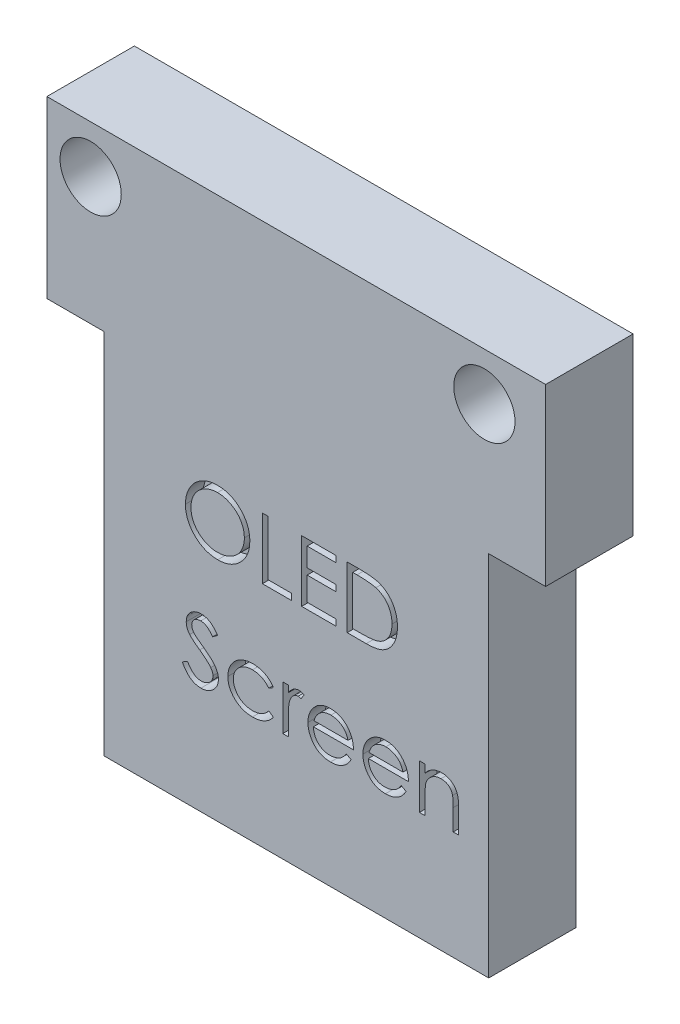
from build123d import *

# Parameters (mm, degrees)
SKETCH1_R           = 1.75
BOSS_EXTRUDE1_DEPTH = 5
CUT_EXTRUDE1_DEPTH  = 1


with BuildPart() as part:
    # Sketch1 → Boss-Extrude1 (new body)
    with BuildSketch(Plane.XY):
        Polygon((14.25, 15.5), (-14.25, 15.5), (-14.25, 5.5), (-11, 5.5), (-11, -15.5), (11, -15.5), (11, 5.5), (14.25, 5.5), align=None)
        with Locations((-11.75, 12.780701754)):
            Circle(SKETCH1_R, mode=Mode.SUBTRACT)
        with Locations((10.75, 12.780701754)):
            Circle(SKETCH1_R, mode=Mode.SUBTRACT)
    extrude(amount=BOSS_EXTRUDE1_DEPTH)

    # Sketch2 → Cut-Extrude1 (cut)
    # profile 1 of 10: a face of its own
    with BuildSketch(Plane.XY.offset(5)):
        with BuildLine():
            add(Edge.make_bspline(
                [(-4.514991702, 1.136077511), (-4.450183596, 1.134436032), (-4.322895129, 1.131212031), (-4.135820231, 1.106532927), (-3.957225136, 1.063837538), (-3.785654997, 1.006974555), (-3.623162021, 0.93112017), (-3.468523128, 0.839435021), (-3.322106254, 0.730958563), (-3.185884873, 0.606529336), (-3.061227922, 0.471145882), (-2.951402036, 0.326667972), (-2.859359742, 0.173969169), (-2.783773955, 0.013508339), (-2.724475346, -0.154351629), (-2.683556302, -0.330505632), (-2.657418152, -0.513812322), (-2.654362374, -0.638839187), (-2.652812215, -0.702263835)],
                knots=[0, 0, 0, 0, 1.065120563, 2.091984664, 3.0946048, 4.079830382, 5.057816894, 6.036188127, 7.030412546, 8.04752943, 9.064399622, 10.05169764, 11.02544977, 11.989514704, 12.962713494, 13.945757189, 14.957906945, 16, 16, 16, 16], degree=3))
            add(Edge.make_bspline(
                [(-2.652812215, -0.702263835), (-2.654362147, -0.765221281), (-2.657417244, -0.889317702), (-2.683586021, -1.071461146), (-2.724627021, -1.246551842), (-2.783223287, -1.414297495), (-2.858448766, -1.574875059), (-2.951103937, -1.727862013), (-3.060245148, -1.873308511), (-3.184451999, -2.009621176), (-3.319853041, -2.134618647), (-3.465083308, -2.243537523), (-3.616876628, -2.337261647), (-3.777186336, -2.412045321), (-3.943886373, -2.471817242), (-4.118468696, -2.512569872), (-4.30011525, -2.538856915), (-4.423986253, -2.541875431), (-4.48694683, -2.543409668)],
                knots=[0, 0, 0, 0, 1.043624062, 2.057103931, 3.04512605, 4.022047818, 4.998200453, 5.980619268, 6.982898556, 8.009068085, 9.034988726, 10.034168286, 11.015286542, 11.987931943, 12.962482838, 13.94673481, 14.956375938, 16, 16, 16, 16], degree=3))
            add(Edge.make_bspline(
                [(-4.48694683, -2.543409668), (-4.550371149, -2.541860281), (-4.675397365, -2.538806027), (-4.8589344, -2.512624623), (-5.035212144, -2.471683319), (-5.203726495, -2.413173883), (-5.364571425, -2.337556652), (-5.518061508, -2.245352273), (-5.663580655, -2.135945132), (-5.799922401, -2.011778557), (-5.9246716, -1.876607005), (-6.033430975, -1.73177275), (-6.125656089, -1.580117293), (-6.201019421, -1.421219769), (-6.26068388, -1.255848326), (-6.301388699, -1.082899849), (-6.327724651, -0.903360343), (-6.330759497, -0.781117445), (-6.332299394, -0.719090758)],
                knots=[0, 0, 0, 0, 1.053102029, 2.075944431, 3.073151272, 4.055350789, 5.033113405, 6.020478099, 7.024410459, 8.052272461, 9.079885166, 10.07527673, 11.055994387, 12.023226415, 12.992069828, 13.970394897, 14.97016774, 16, 16, 16, 16], degree=3))
            add(Edge.make_bspline(
                [(-6.332299394, -0.719090758), (-6.331764759, -0.677458089), (-6.330702232, -0.594717965), (-6.31791054, -0.471851365), (-6.299348839, -0.350960707), (-6.272746926, -0.232389759), (-6.237955259, -0.116428775), (-6.196903232, -0.002278012), (-6.146763386, 0.108905712), (-6.090082738, 0.217649104), (-6.02682093, 0.322257009), (-5.956945181, 0.421136593), (-5.882909812, 0.515117589), (-5.801746419, 0.601764593), (-5.716129974, 0.68359825), (-5.624671595, 0.759360967), (-5.527929351, 0.829735918), (-5.425486971, 0.893156259), (-5.319868696, 0.950515393), (-5.210991919, 0.999737244), (-5.100335347, 1.041983306), (-4.987380699, 1.076224131), (-4.872427927, 1.103256167), (-4.755226143, 1.121663521), (-4.635868716, 1.134487839), (-4.555457397, 1.135545341), (-4.514991702, 1.136077511)],
                knots=[0, 0, 0, 0, 1.037015668, 2.060948919, 3.074880161, 4.083647147, 5.086022904, 6.090072063, 7.104153813, 8.122640571, 9.144368836, 10.147691507, 11.138137339, 12.123020368, 13.103399296, 14.087645067, 15.080126199, 16.082011238, 17.087798457, 18.072939717, 19.057185487, 20.037253025, 21.01195951, 21.997135196, 22.992090687, 24, 24, 24, 24], degree=3))
        make_face()
        with BuildLine():
            add(Edge.make_bspline(
                [(-4.499567022, 0.777103152), (-4.532781656, 0.776698262), (-4.598893389, 0.775892352), (-4.697177925, 0.765276637), (-4.794169859, 0.750146748), (-4.889889221, 0.728565227), (-4.98393551, 0.699161174), (-5.077185352, 0.665320266), (-5.168788405, 0.624099176), (-5.258442263, 0.577526471), (-5.345357338, 0.52597755), (-5.42737004, 0.469005783), (-5.504692684, 0.407947229), (-5.577135951, 0.342659392), (-5.644487123, 0.27280979), (-5.708071824, 0.199457354), (-5.765341406, 0.120505463), (-5.817826983, 0.038095056), (-5.864794823, -0.047666525), (-5.906560178, -0.135876388), (-5.940724186, -0.227254074), (-5.968586563, -0.320808232), (-5.991686374, -0.416390692), (-6.006320298, -0.51472654), (-6.017052657, -0.615321653), (-6.017812503, -0.683303507), (-6.01819683, -0.717688514)],
                knots=[0, 0, 0, 0, 1.008559885, 2.007477868, 2.99961109, 3.989939068, 4.984837346, 5.991145699, 7.001802488, 8.033829008, 9.059044045, 10.069351652, 11.065060232, 12.050310815, 13.029377138, 14.011219647, 14.996725999, 15.989392538, 16.977580475, 17.965360261, 18.951710183, 19.937753436, 20.929683414, 21.935841486, 22.955955122, 24, 24, 24, 24], degree=3))
            add(Edge.make_bspline(
                [(-6.01819683, -0.717688514), (-6.016921968, -0.768250735), (-6.01441392, -0.867722265), (-5.99245635, -1.013490409), (-5.958634376, -1.153578696), (-5.908777009, -1.287220605), (-5.846426395, -1.415564888), (-5.769399504, -1.537472992), (-5.678140419, -1.652977867), (-5.574476892, -1.761273136), (-5.461154185, -1.86011894), (-5.340821456, -1.946882349), (-5.214767848, -2.020292598), (-5.082664645, -2.080097671), (-4.945217106, -2.127487409), (-4.801539555, -2.15996604), (-4.652589096, -2.181341495), (-4.551058441, -2.183394251), (-4.499567022, -2.184435309)],
                knots=[0, 0, 0, 0, 1.032063989, 2.030389145, 3.003944642, 3.970395727, 4.937377036, 5.913328081, 6.909231446, 7.93887556, 8.970685674, 9.976071282, 10.964166581, 11.944589148, 12.933237628, 13.927779006, 14.949070134, 16, 16, 16, 16], degree=3))
            add(Edge.make_bspline(
                [(-4.499567022, -2.184435309), (-4.464957521, -2.183959805), (-4.396316484, -2.183016737), (-4.294220962, -2.17351806), (-4.19396475, -2.158286191), (-4.09568847, -2.136355535), (-3.999503659, -2.108908329), (-3.905008856, -2.076300601), (-3.813210566, -2.035619397), (-3.722950728, -1.990671445), (-3.636554486, -1.939431288), (-3.554078954, -1.884393138), (-3.477602974, -1.823424517), (-3.405213903, -1.759106705), (-3.337586214, -1.690142857), (-3.275177229, -1.616622635), (-3.218197097, -1.538081978), (-3.165731451, -1.455796572), (-3.118928188, -1.36980032), (-3.078149089, -1.281270642), (-3.043552973, -1.190425532), (-3.015624468, -1.097133961), (-2.993739006, -1.001573112), (-2.978659086, -0.903615034), (-2.968110648, -0.803455691), (-2.967315571, -0.735711835), (-2.966914779, -0.701562713)],
                knots=[0, 0, 0, 0, 1.047197238, 2.076906641, 3.100256066, 4.114471768, 5.12198147, 6.126382909, 7.136867548, 8.15857795, 9.17633901, 10.174870724, 11.156907918, 12.133735059, 13.104061851, 14.077631395, 15.04955518, 16.038496417, 17.029181396, 18.010275684, 18.986308667, 19.968651475, 20.955262928, 21.950658345, 22.966943676, 24, 24, 24, 24], degree=3))
            add(Edge.make_bspline(
                [(-2.966914779, -0.701562713), (-2.967315892, -0.667647209), (-2.968111573, -0.600369559), (-2.978654048, -0.50090874), (-2.993754938, -0.403655529), (-3.015517646, -0.308991726), (-3.0435678, -0.216893201), (-3.07815513, -0.127446453), (-3.11894043, -0.040318258), (-3.165748654, 0.044276039), (-3.218364478, 0.125450777), (-3.275858721, 0.20305319), (-3.339224069, 0.275625931), (-3.406650094, 0.344960625), (-3.479820979, 0.409578515), (-3.558405273, 0.469501035), (-3.641448951, 0.52617431), (-3.729376187, 0.577299871), (-3.82012014, 0.624514104), (-3.913234098, 0.664965107), (-4.007663198, 0.699337227), (-4.10316731, 0.728654192), (-4.200550289, 0.750062222), (-4.299154117, 0.765290272), (-4.398842376, 0.775888658), (-4.465885596, 0.776697036), (-4.499567022, 0.777103152)],
                knots=[0, 0, 0, 0, 1.02996197, 2.043119294, 3.035359645, 4.018872909, 4.991431989, 5.957985074, 6.929999688, 7.912076566, 8.892894881, 9.867085534, 10.843653904, 11.817741046, 12.803660682, 13.806313499, 14.818574707, 15.856120519, 16.894564902, 17.924820532, 18.937903209, 19.946497019, 20.957711757, 21.963978472, 22.977135795, 24, 24, 24, 24], degree=3))
        make_face(mode=Mode.SUBTRACT)
    # profile 2 of 10: a face of its own
    with BuildSketch(Plane.XY.offset(5)):
        Polygon((-1.934863497, 1.046333922), (-1.620760933, 1.046333922), (-1.620760933, -2.094691719), (-0.274607086, -2.094691719), (-0.274607086, -2.453666078), (-1.934863497, -2.453666078), align=None)
    # profile 3 of 10: a face of its own
    with BuildSketch(Plane.XY.offset(5)):
        Polygon((0.308726247, 1.046333922), (2.283085221, 1.046333922), (2.283085221, 0.687359563), (0.622828811, 0.687359563), (0.622828811, -0.389563514), (2.283085221, -0.389563514), (2.283085221, -0.748537873), (0.622828811, -0.748537873), (0.622828811, -2.094691719), (2.283085221, -2.094691719), (2.283085221, -2.453666078), (0.308726247, -2.453666078), align=None)
    # profile 4 of 10: a face of its own
    with BuildSketch(Plane.XY.offset(5)):
        with BuildLine():
            Line((2.911290349, -2.453666078), (2.911290349, 1.046333922))
            Line((2.911290349, 1.046333922), (3.618021119, 1.046333922))
            add(Edge.make_bspline(
                [(3.618021119, 1.046333922), (3.679490107, 1.045891352), (3.798247872, 1.045036309), (3.96986032, 1.039614918), (4.128644082, 1.030024452), (4.274076941, 1.016054926), (4.406558153, 0.998901892), (4.525716761, 0.977401488), (4.632168904, 0.952013317), (4.697638345, 0.930367867), (4.728598042, 0.920131999)],
                knots=[0, 0, 0, 0, 1.314313732, 2.53924729, 3.670748893, 4.714932338, 5.66265055, 6.526160246, 7.303039223, 8, 8, 8, 8], degree=3))
            add(Edge.make_bspline(
                [(4.728598042, 0.920131999), (4.769092781, 0.904701293), (4.849163973, 0.874189799), (4.963171096, 0.816633497), (5.070496459, 0.751420396), (5.171715604, 0.678464533), (5.26451643, 0.595700185), (5.352524327, 0.506643099), (5.432139051, 0.408054759), (5.505047347, 0.301979771), (5.570783006, 0.189667718), (5.627922164, 0.07133261), (5.675376157, -0.052424598), (5.714769384, -0.181259746), (5.745815842, -0.315456124), (5.766997773, -0.45516999), (5.780968763, -0.59984918), (5.782372814, -0.698023643), (5.783085221, -0.747836751)],
                knots=[0, 0, 0, 0, 0.984719456, 1.947108742, 2.898477687, 3.838006223, 4.779231079, 5.722358779, 6.681677486, 7.655904652, 8.64651281, 9.637519902, 10.640069247, 11.656948941, 12.698408672, 13.768548281, 14.867775369, 16, 16, 16, 16], degree=3))
            add(Edge.make_bspline(
                [(5.783085221, -0.747836751), (5.782456254, -0.79109799), (5.781216808, -0.876348779), (5.770087492, -1.001989675), (5.753911172, -1.123903246), (5.728866974, -1.241508946), (5.69846446, -1.355837164), (5.659500309, -1.465669408), (5.614864813, -1.572013217), (5.562814934, -1.673430693), (5.505673549, -1.769514066), (5.444351806, -1.860089594), (5.378915111, -1.943864816), (5.308739478, -2.021093428), (5.234731761, -2.091659006), (5.156407431, -2.156151021), (5.07356438, -2.213307576), (4.986573657, -2.265374685), (4.892897528, -2.31079504), (4.790761662, -2.34922505), (4.679730484, -2.381071665), (4.560076527, -2.407642561), (4.431593049, -2.428719864), (4.294154084, -2.442846256), (4.147970794, -2.452399189), (4.047591529, -2.453235582), (3.995925766, -2.453666078)],
                knots=[0, 0, 0, 0, 1.105936401, 2.179363191, 3.223086493, 4.248585256, 5.251745608, 6.245858792, 7.225916811, 8.198733463, 9.158002045, 10.082870192, 10.993790845, 11.873723703, 12.748670949, 13.606408763, 14.465103618, 15.319838547, 16.196477973, 17.123216899, 18.106603292, 19.147568657, 20.255746949, 21.433717677, 22.679120308, 24, 24, 24, 24], degree=3))
            Line((3.995925766, -2.453666078), (2.911290349, -2.453666078))
        make_face()
        with BuildLine():
            Line((3.225392914, -2.094691719), (3.627135702, -2.094691719))
            add(Edge.make_bspline(
                [(3.627135702, -2.094691719), (3.684864073, -2.094443623), (3.795896871, -2.093966443), (3.955554868, -2.08977924), (4.101434265, -2.082937302), (4.233555774, -2.073362224), (4.351844799, -2.060693609), (4.456548549, -2.046568707), (4.547323807, -2.028971256), (4.602253244, -2.013020296), (4.627636503, -2.005649251)],
                knots=[0, 0, 0, 0, 1.375205317, 2.645023457, 3.804390687, 4.853969522, 5.800190428, 6.637939096, 7.370582563, 8, 8, 8, 8], degree=3))
            add(Edge.make_bspline(
                [(4.627636503, -2.005649251), (4.659584865, -1.994397693), (4.722718504, -1.97216332), (4.813599589, -1.931605659), (4.898356593, -1.883563589), (4.978466619, -1.830161315), (5.052793274, -1.769515313), (5.12221739, -1.702944324), (5.186599192, -1.630109549), (5.2452735, -1.551101388), (5.297781804, -1.466411592), (5.343253033, -1.376872758), (5.383104565, -1.283465948), (5.414383157, -1.184756789), (5.438898742, -1.081627731), (5.45626343, -0.974071518), (5.467078154, -0.862108236), (5.468339602, -0.785956112), (5.468982657, -0.74713563)],
                knots=[0, 0, 0, 0, 0.998632004, 1.973411704, 2.929992603, 3.868527914, 4.809262121, 5.754881198, 6.702106254, 7.672490631, 8.653608572, 9.636854334, 10.631411391, 11.644891563, 12.686317036, 13.754757253, 14.855430412, 16, 16, 16, 16], degree=3))
            add(Edge.make_bspline(
                [(5.468982657, -0.74713563), (5.46846937, -0.706202149), (5.467461012, -0.625787965), (5.454786702, -0.50779727), (5.436265146, -0.394316619), (5.40948146, -0.285338424), (5.375350581, -0.180650072), (5.33275594, -0.080830561), (5.28408932, 0.015174307), (5.226185984, 0.105148673), (5.16277039, 0.190241782), (5.092392511, 0.268196698), (5.016170472, 0.339190998), (4.934935623, 0.404330311), (4.846398524, 0.460993987), (4.752644833, 0.511680668), (4.652299162, 0.554696559), (4.582486466, 0.577575422), (4.547007497, 0.589202511)],
                knots=[0, 0, 0, 0, 1.122418816, 2.205001699, 3.251619955, 4.274784885, 5.280384055, 6.268708349, 7.249350384, 8.229342522, 9.199999885, 10.157847722, 11.105861043, 12.055065948, 13.010012805, 13.98527497, 14.976112212, 16, 16, 16, 16], degree=3))
            add(Edge.make_bspline(
                [(4.547007497, 0.589202511), (4.517656351, 0.597318939), (4.45524776, 0.614576692), (4.353408296, 0.633402064), (4.238793147, 0.650006563), (4.110893446, 0.664064603), (3.969854987, 0.674151924), (3.815569299, 0.681723239), (3.647969694, 0.686829871), (3.53178716, 0.687178578), (3.471486664, 0.687359563)],
                knots=[0, 0, 0, 0, 0.674548936, 1.434276114, 2.292660221, 3.240891867, 4.284742987, 5.42552168, 6.663806718, 8, 8, 8, 8], degree=3))
            Line((3.471486664, 0.687359563), (3.225392914, 0.687359563))
            Line((3.225392914, 0.687359563), (3.225392914, -2.094691719))
        make_face(mode=Mode.SUBTRACT)
    # profile 5 of 10: a face of its own
    with BuildSketch(Plane.XY.offset(5)):
        with BuildLine():
            Line((-6.511786574, -8.611819123), (-6.215913176, -8.434435309))
            add(Edge.make_bspline(
                [(-6.215913176, -8.434435309), (-6.188394939, -8.480499694), (-6.135671058, -8.568757278), (-6.047719699, -8.688015318), (-5.956586788, -8.789377475), (-5.861597454, -8.872254083), (-5.763331506, -8.93750297), (-5.661147453, -8.983705201), (-5.555389642, -9.012521177), (-5.48341582, -9.016021263), (-5.447483689, -9.017768643)],
                knots=[0, 0, 0, 0, 1.272034388, 2.437168799, 3.508375237, 4.49857839, 5.41946034, 6.295179144, 7.148887113, 8, 8, 8, 8], degree=3))
            add(Edge.make_bspline(
                [(-5.447483689, -9.017768643), (-5.416796828, -9.01691397), (-5.355960055, -9.01521958), (-5.266397812, -8.998938778), (-5.17941601, -8.973926649), (-5.096807372, -8.938105717), (-5.019711758, -8.894767232), (-4.952105063, -8.842421054), (-4.893658949, -8.783814848), (-4.845849835, -8.718432194), (-4.8091698, -8.648115045), (-4.780977731, -8.575939094), (-4.765332658, -8.500770525), (-4.762975904, -8.450160063), (-4.761786574, -8.424619604)],
                knots=[0, 0, 0, 0, 1.095163259, 2.171163733, 3.241058638, 4.321873601, 5.38011039, 6.391990106, 7.366004449, 8.327778327, 9.272591725, 10.192022065, 11.087607919, 12, 12, 12, 12], degree=3))
            add(Edge.make_bspline(
                [(-4.761786574, -8.424619604), (-4.763260884, -8.395478754), (-4.766257943, -8.336239665), (-4.791589423, -8.248840012), (-4.831438669, -8.162347442), (-4.868201313, -8.108846177), (-4.887287375, -8.081069925)],
                knots=[0, 0, 0, 0, 0.938893495, 1.908633276, 2.914225137, 4, 4, 4, 4], degree=3))
            add(Edge.make_bspline(
                [(-4.887287375, -8.081069925), (-4.902957989, -8.061023101), (-4.935856483, -8.018937302), (-4.992413996, -7.956292067), (-5.05878011, -7.891673648), (-5.132683665, -7.822614591), (-5.216816754, -7.752326794), (-5.308544268, -7.677458516), (-5.410208127, -7.600856939), (-5.481507624, -7.549484374), (-5.51829699, -7.522976976)],
                knots=[0, 0, 0, 0, 0.722233717, 1.516239348, 2.393582979, 3.351407094, 4.387010283, 5.505090956, 6.712668013, 8, 8, 8, 8], degree=3))
            add(Edge.make_bspline(
                [(-5.51829699, -7.522976976), (-5.555120986, -7.496748388), (-5.625525663, -7.446601326), (-5.723984245, -7.372177042), (-5.812028708, -7.304133172), (-5.889267725, -7.24182916), (-5.955667322, -7.185256556), (-6.011750733, -7.134958616), (-6.05608929, -7.089575056), (-6.080744871, -7.060133714), (-6.091814618, -7.046915277)],
                knots=[0, 0, 0, 0, 1.452282411, 2.77665338, 3.964542531, 5.026858415, 5.96415736, 6.766646006, 7.446254459, 8, 8, 8, 8], degree=3))
            add(Edge.make_bspline(
                [(-6.091814618, -7.046915277), (-6.107287164, -7.02631424), (-6.137716, -6.985799537), (-6.177882006, -6.922474679), (-6.212021169, -6.857651413), (-6.238783501, -6.791155549), (-6.26131972, -6.72392062), (-6.27647765, -6.655069374), (-6.285969047, -6.584910756), (-6.286941034, -6.537697255), (-6.287427599, -6.514062713)],
                knots=[0, 0, 0, 0, 1.068054152, 2.10047183, 3.106115577, 4.101338837, 5.06977816, 6.043150881, 7.020423561, 8, 8, 8, 8], degree=3))
            add(Edge.make_bspline(
                [(-6.287427599, -6.514062713), (-6.28612239, -6.477032938), (-6.28353987, -6.403764875), (-6.261699353, -6.296734044), (-6.227226459, -6.194547627), (-6.178931571, -6.098217293), (-6.116674218, -6.010251312), (-6.044628244, -5.929637825), (-5.958816758, -5.861869243), (-5.864664135, -5.802657185), (-5.761607763, -5.75631126), (-5.653616859, -5.721350279), (-5.540519787, -5.701541022), (-5.463916652, -5.698698257), (-5.425047792, -5.697255822)],
                knots=[0, 0, 0, 0, 1.005424448, 1.989358655, 2.955360095, 3.929531133, 4.905563448, 5.876582895, 6.856512386, 7.866279853, 8.892233794, 9.918561126, 10.94386622, 12, 12, 12, 12], degree=3))
            add(Edge.make_bspline(
                [(-5.425047792, -5.697255822), (-5.383803691, -5.698678374), (-5.30178234, -5.701507375), (-5.181133124, -5.726104906), (-5.064972408, -5.766805578), (-4.971529143, -5.812994236), (-4.898396381, -5.859125652), (-4.842623649, -5.901145476), (-4.786106198, -5.949520584), (-4.728388143, -6.00437983), (-4.670447484, -6.066226582), (-4.611424031, -6.13463727), (-4.551179762, -6.209193826), (-4.512423902, -6.262418327), (-4.492555804, -6.289703739)],
                knots=[0, 0, 0, 0, 1.286793592, 2.559021753, 3.825965368, 5.121522368, 5.803751409, 6.523245864, 7.299691795, 8.125521123, 9.008227632, 9.944561021, 10.946284179, 12, 12, 12, 12], degree=3))
            Line((-4.492555804, -6.289703739), (-4.776510131, -6.50494813))
            add(Edge.make_bspline(
                [(-4.776510131, -6.50494813), (-4.793656064, -6.482859439), (-4.826675121, -6.440321786), (-4.876804608, -6.38075047), (-4.924053256, -6.326333991), (-4.970603655, -6.279068863), (-5.013997287, -6.23636673), (-5.056114329, -6.199806973), (-5.09634868, -6.169031377), (-5.147065591, -6.136187817), (-5.210783309, -6.103631314), (-5.290767846, -6.076082236), (-5.374354121, -6.059527174), (-5.431283752, -6.057338286), (-5.460103881, -6.056230181)],
                knots=[0, 0, 0, 0, 1.181633172, 2.275549214, 3.290209073, 4.226197932, 5.078386478, 5.862611352, 6.581680152, 7.217281963, 8.414376989, 9.595101626, 10.782541182, 12, 12, 12, 12], degree=3))
            add(Edge.make_bspline(
                [(-5.460103881, -6.056230181), (-5.496260404, -6.057441881), (-5.565984851, -6.05977853), (-5.664975087, -6.085298515), (-5.754069012, -6.125480376), (-5.830621577, -6.181795354), (-5.894358554, -6.248516347), (-5.940464013, -6.325295202), (-5.968214178, -6.410077604), (-5.971600457, -6.469219261), (-5.973325035, -6.499339155)],
                knots=[0, 0, 0, 0, 1.14458467, 2.207223713, 3.21896685, 4.227309161, 5.202851033, 6.127160689, 7.046193047, 8, 8, 8, 8], degree=3))
            add(Edge.make_bspline(
                [(-5.973325035, -6.499339155), (-5.972931909, -6.518090634), (-5.972145012, -6.555624253), (-5.961170215, -6.611075675), (-5.947070886, -6.666387015), (-5.924728254, -6.721309598), (-5.89388295, -6.776803957), (-5.853377774, -6.833825694), (-5.802364462, -6.892877403), (-5.76328745, -6.931284777), (-5.742655965, -6.951562713)],
                knots=[0, 0, 0, 0, 0.858281714, 1.717966888, 2.583508476, 3.4729293, 4.427298488, 5.488583878, 6.674047936, 8, 8, 8, 8], degree=3))
            add(Edge.make_bspline(
                [(-5.742655965, -6.951562713), (-5.734994592, -6.958399739), (-5.716792925, -6.974642947), (-5.683516999, -7.001235228), (-5.639574201, -7.034038), (-5.586112, -7.074625317), (-5.522144638, -7.121706779), (-5.447665082, -7.174680391), (-5.363503549, -7.23526585), (-5.303781633, -7.27762339), (-5.27220324, -7.300020245)],
                knots=[0, 0, 0, 0, 0.420754252, 0.999615792, 1.744751191, 2.668019286, 3.750313428, 4.999500688, 6.413464383, 8, 8, 8, 8], degree=3))
            add(Edge.make_bspline(
                [(-5.27220324, -7.300020245), (-5.234217327, -7.327661605), (-5.160662871, -7.381185266), (-5.056005291, -7.461600946), (-4.961111483, -7.540248715), (-4.875648279, -7.616626322), (-4.798771371, -7.690154415), (-4.73133365, -7.761717595), (-4.67264797, -7.830803168), (-4.609468751, -7.919375744), (-4.544910932, -8.028156828), (-4.489469424, -8.161435067), (-4.454511077, -8.295231387), (-4.449939561, -8.385158224), (-4.44768401, -8.429527457)],
                knots=[0, 0, 0, 0, 1.163667725, 2.253281268, 3.268753668, 4.215851969, 5.092017293, 5.902905408, 6.650798638, 7.335211899, 8.59617414, 9.77448103, 10.901945474, 12, 12, 12, 12], degree=3))
            add(Edge.make_bspline(
                [(-4.44768401, -8.429527457), (-4.448341148, -8.460905822), (-4.449642663, -8.523053205), (-4.464603576, -8.614308282), (-4.486523242, -8.702939152), (-4.519560476, -8.787850264), (-4.559883634, -8.870595027), (-4.611049882, -8.949002927), (-4.670357566, -9.024809326), (-4.738391331, -9.095992817), (-4.812837234, -9.161339013), (-4.891520928, -9.219468075), (-4.974571201, -9.267936398), (-5.061537518, -9.30748724), (-5.152439855, -9.338420758), (-5.247247639, -9.360833627), (-5.34611715, -9.374589338), (-5.413317631, -9.376017099), (-5.447483689, -9.376743001)],
                knots=[0, 0, 0, 0, 0.983748083, 1.948392443, 2.894712957, 3.844097841, 4.80183111, 5.778335162, 6.776009319, 7.81870978, 8.863265674, 9.881300176, 10.883814829, 11.87499822, 12.874611388, 13.892143829, 14.928324115, 16, 16, 16, 16], degree=3))
            add(Edge.make_bspline(
                [(-5.447483689, -9.376743001), (-5.473919032, -9.37623182), (-5.526456792, -9.375215895), (-5.604166274, -9.366234614), (-5.680305863, -9.35352751), (-5.753920145, -9.333353441), (-5.825957557, -9.308876463), (-5.896104791, -9.278738131), (-5.964395845, -9.242620929), (-6.031213428, -9.201325905), (-6.096387603, -9.15326816), (-6.159307071, -9.097294664), (-6.222036256, -9.034949159), (-6.282723652, -8.964538595), (-6.342596797, -8.887200513), (-6.400475206, -8.802211329), (-6.457556924, -8.710033975), (-6.493372392, -8.64516889), (-6.511786574, -8.611819123)],
                knots=[0, 0, 0, 0, 0.915332311, 1.819136955, 2.706846663, 3.586547465, 4.459518054, 5.340707479, 6.227863349, 7.133153174, 8.059268498, 9.028702269, 10.047606654, 11.120612155, 12.245963614, 13.433783089, 14.680604001, 16, 16, 16, 16], degree=3))
        make_face()
    # profile 6 of 10: a face of its own
    with BuildSketch(Plane.XY.offset(5)):
        with BuildLine():
            Line((-1.306658368, -7.283894444), (-1.569579042, -7.447255822))
            add(Edge.make_bspline(
                [(-1.569579042, -7.447255822), (-1.598408907, -7.411427428), (-1.655155602, -7.340905318), (-1.753694839, -7.249895385), (-1.858706253, -7.171728343), (-1.9719843, -7.108024592), (-2.093370101, -7.058803142), (-2.222384952, -7.023972936), (-2.359010457, -7.002268693), (-2.452675656, -6.999801856), (-2.500668785, -6.998537873)],
                knots=[0, 0, 0, 0, 1.026593902, 2.0206758, 2.988051866, 3.946915611, 4.916868779, 5.907761954, 6.927957743, 8, 8, 8, 8], degree=3))
            add(Edge.make_bspline(
                [(-2.500668785, -6.998537873), (-2.539027742, -6.999594715), (-2.614574665, -7.001676137), (-2.725480818, -7.014686631), (-2.831123171, -7.038328639), (-2.93216388, -7.069479596), (-3.027884299, -7.111229886), (-3.118535217, -7.162039642), (-3.204920707, -7.221089682), (-3.284537449, -7.289500228), (-3.357366456, -7.363898895), (-3.42046537, -7.443652591), (-3.475402303, -7.526372482), (-3.518508259, -7.614124224), (-3.55378343, -7.704900277), (-3.57699015, -7.800414133), (-3.592454845, -7.899442141), (-3.594224174, -7.96696048), (-3.595119907, -8.00114204)],
                knots=[0, 0, 0, 0, 1.112346261, 2.190735716, 3.231507886, 4.247384806, 5.251966152, 6.253067467, 7.256802811, 8.280671706, 9.291813951, 10.270744147, 11.225547591, 12.165006084, 13.100104208, 14.043489273, 15.009504848, 16, 16, 16, 16], degree=3))
            add(Edge.make_bspline(
                [(-3.595119907, -8.00114204), (-3.593340655, -8.045911251), (-3.589806124, -8.134846447), (-3.562104664, -8.266124549), (-3.516760257, -8.393048239), (-3.454702407, -8.514716376), (-3.376225272, -8.627310531), (-3.284052709, -8.728293986), (-3.178133626, -8.815710014), (-3.059401295, -8.888182539), (-2.930643551, -8.946443907), (-2.793253447, -8.987951239), (-2.648353666, -9.013003612), (-2.549146919, -9.016159555), (-2.49856542, -9.017768643)],
                knots=[0, 0, 0, 0, 0.966302908, 1.919585723, 2.883856336, 3.870342332, 4.860282998, 5.839159637, 6.814385684, 7.815993281, 8.834850808, 9.858348828, 10.908058873, 12, 12, 12, 12], degree=3))
            add(Edge.make_bspline(
                [(-2.49856542, -9.017768643), (-2.452210235, -9.016469145), (-2.361109997, -9.013915288), (-2.227942712, -8.992386325), (-2.101162801, -8.957142692), (-1.98077477, -8.907995042), (-1.866998604, -8.844467526), (-1.76056943, -8.766108355), (-1.659369491, -8.675171754), (-1.599872515, -8.604853783), (-1.569579042, -8.569050694)],
                knots=[0, 0, 0, 0, 1.039848629, 2.043578496, 3.018386758, 3.987534228, 4.954977003, 5.934852016, 6.948509513, 8, 8, 8, 8], degree=3))
            Line((-1.569579042, -8.569050694), (-1.306658368, -8.741526655))
            add(Edge.make_bspline(
                [(-1.306658368, -8.741526655), (-1.322246071, -8.764417382), (-1.353369738, -8.810122859), (-1.405397363, -8.874566976), (-1.461517195, -8.934888658), (-1.521510292, -8.991007048), (-1.584593301, -9.044265067), (-1.652921211, -9.092116642), (-1.724290823, -9.137251464), (-1.79953998, -9.177864337), (-1.877890678, -9.214370658), (-1.959232668, -9.245761829), (-2.043212481, -9.272731935), (-2.129928857, -9.294169282), (-2.219552755, -9.31128012), (-2.311852389, -9.322633822), (-2.406795971, -9.331109103), (-2.470968122, -9.33161497), (-2.503473272, -9.331871207)],
                knots=[0, 0, 0, 0, 0.954134338, 1.905101784, 2.851144739, 3.791306361, 4.734911809, 5.6936923, 6.663572882, 7.643865596, 8.638447847, 9.640600242, 10.646758161, 11.676244097, 12.717260333, 13.78922464, 14.880174919, 16, 16, 16, 16], degree=3))
            add(Edge.make_bspline(
                [(-2.503473272, -9.331871207), (-2.553084156, -9.330979927), (-2.650321848, -9.329233012), (-2.792644356, -9.310024537), (-2.928658023, -9.28106692), (-3.058316381, -9.239503186), (-3.181639615, -9.185998411), (-3.298512733, -9.120641497), (-3.408548752, -9.042889707), (-3.510659534, -8.954126937), (-3.604440981, -8.857886296), (-3.684967171, -8.754036378), (-3.754812441, -8.64639533), (-3.810899985, -8.532585804), (-3.855546911, -8.414120432), (-3.886051744, -8.290050192), (-3.905781481, -8.161397938), (-3.908064861, -8.073665056), (-3.909222471, -8.029186912)],
                knots=[0, 0, 0, 0, 1.1129367, 2.181364009, 3.217532258, 4.231199276, 5.232079859, 6.230262199, 7.231623845, 8.250719726, 9.263571943, 10.242672461, 11.195837495, 12.138959767, 13.085126421, 14.0317438, 15.002148558, 16, 16, 16, 16], degree=3))
            add(Edge.make_bspline(
                [(-3.909222471, -8.029186912), (-3.908781455, -7.999008477), (-3.907904201, -7.93897859), (-3.897842273, -7.849883523), (-3.8848438, -7.761974978), (-3.862818063, -7.676367259), (-3.837377432, -7.591761968), (-3.8049019, -7.509178867), (-3.766806505, -7.428234194), (-3.723554558, -7.349136465), (-3.674865812, -7.273186925), (-3.620984579, -7.201433261), (-3.563940243, -7.133013495), (-3.501064131, -7.070289734), (-3.435024477, -7.010753543), (-3.363952901, -6.955995419), (-3.28825705, -6.905854428), (-3.209073727, -6.859403412), (-3.126449016, -6.818043977), (-3.040882346, -6.782410739), (-2.952889316, -6.751958164), (-2.862329172, -6.727849244), (-2.769802999, -6.707631821), (-2.674581661, -6.694913975), (-2.577029439, -6.685927702), (-2.510973416, -6.68493691), (-2.477531766, -6.684435309)],
                knots=[0, 0, 0, 0, 0.990994727, 1.971252077, 2.943264845, 3.907940874, 4.872158414, 5.844625996, 6.82015047, 7.809835459, 8.804511986, 9.781214284, 10.756496977, 11.728388426, 12.696359165, 13.676225489, 14.672885716, 15.677705647, 16.690706858, 17.706033469, 18.721040654, 19.747369689, 20.783475414, 21.830280724, 22.901553713, 24, 24, 24, 24], degree=3))
            add(Edge.make_bspline(
                [(-2.477531766, -6.684435309), (-2.435651658, -6.6853572), (-2.352100778, -6.687196374), (-2.228160072, -6.702675027), (-2.106044878, -6.726011443), (-1.987897774, -6.760584273), (-1.87515126, -6.802447928), (-1.76961581, -6.849460643), (-1.673775706, -6.904055246), (-1.585848117, -6.963775361), (-1.505668599, -7.031136266), (-1.432414107, -7.106943224), (-1.364582457, -7.190801703), (-1.326125746, -7.252607434), (-1.306658368, -7.283894444)],
                knots=[0, 0, 0, 0, 1.095225653, 2.184976855, 3.262915854, 4.344593502, 5.400796181, 6.407717688, 7.363229445, 8.282371371, 9.184954523, 10.097238608, 11.036792983, 12, 12, 12, 12], degree=3))
        make_face()
    # profile 7 of 10: a face of its own
    with BuildSketch(Plane.XY.offset(5)):
        with BuildLine():
            Line((-0.76819683, -6.729307104), (-0.454094266, -6.729307104))
            Line((-0.454094266, -6.729307104), (-0.454094266, -7.105809508))
            add(Edge.make_bspline(
                [(-0.454094266, -7.105809508), (-0.430905507, -7.07075368), (-0.386557186, -7.00370968), (-0.312844257, -6.915040379), (-0.237340926, -6.841625333), (-0.159685738, -6.783121814), (-0.079307638, -6.739308695), (0.002029313, -6.70721566), (0.085604783, -6.688238345), (0.141766707, -6.685704686), (0.169904132, -6.684435309)],
                knots=[0, 0, 0, 0, 1.2804753, 2.448899062, 3.506932113, 4.484331642, 5.4025378, 6.288909075, 7.142734305, 8, 8, 8, 8], degree=3))
            add(Edge.make_bspline(
                [(0.169904132, -6.684435309), (0.191730458, -6.685625836), (0.236639543, -6.688075422), (0.304622133, -6.705286246), (0.374665585, -6.732764269), (0.419807972, -6.758604491), (0.443341632, -6.772075534)],
                knots=[0, 0, 0, 0, 0.901110191, 1.854092781, 2.881294221, 4, 4, 4, 4], degree=3))
            Line((0.443341632, -6.772075534), (0.27086567, -7.04411079))
            add(Edge.make_bspline(
                [(0.27086567, -7.04411079), (0.255756649, -7.037370524), (0.227076834, -7.024576208), (0.185122268, -7.009434198), (0.146440931, -7.000518282), (0.121797373, -6.999167565), (0.110308779, -6.998537873)],
                knots=[0, 0, 0, 0, 1.180555205, 2.24091978, 3.179933427, 4, 4, 4, 4], degree=3))
            add(Edge.make_bspline(
                [(0.110308779, -6.998537873), (0.085103045, -7.000217911), (0.033690655, -7.0036447), (-0.041793844, -7.030583508), (-0.115041049, -7.074108748), (-0.173212712, -7.12237986), (-0.218254965, -7.168927657), (-0.25039519, -7.20957606), (-0.279877937, -7.255154691), (-0.308048158, -7.304884375), (-0.333714452, -7.359614221), (-0.357669121, -7.418797434), (-0.379327984, -7.482502563), (-0.391678228, -7.526885083), (-0.398004522, -7.549619604)],
                knots=[0, 0, 0, 0, 1.125678352, 2.296057538, 3.5422874, 4.923748041, 5.663163013, 6.437101912, 7.23742474, 8.08941207, 8.991984279, 9.93940061, 10.944477711, 12, 12, 12, 12], degree=3))
            add(Edge.make_bspline(
                [(-0.398004522, -7.549619604), (-0.402736916, -7.569896778), (-0.413218807, -7.614809176), (-0.423410345, -7.690157701), (-0.433479863, -7.77918136), (-0.440576482, -7.882127953), (-0.447154524, -7.998740397), (-0.450864606, -8.129196342), (-0.453967746, -8.273629693), (-0.454050813, -8.374604047), (-0.454094266, -8.427424091)],
                knots=[0, 0, 0, 0, 0.566838948, 1.255505196, 2.06880316, 3.007127437, 4.065329342, 5.249902469, 6.561414163, 8, 8, 8, 8], degree=3))
            Line((-0.454094266, -8.427424091), (-0.454094266, -9.286999412))
            Line((-0.454094266, -9.286999412), (-0.76819683, -9.286999412))
            Line((-0.76819683, -9.286999412), (-0.76819683, -6.729307104))
        make_face()
    # profile 8 of 10: a face of its own
    with BuildSketch(Plane.XY.offset(5)):
        with BuildLine():
            Line((2.856602849, -8.479307104), (3.135649324, -8.625841559))
            add(Edge.make_bspline(
                [(3.135649324, -8.625841559), (3.113412729, -8.66528489), (3.07014912, -8.742025993), (2.995748372, -8.847457854), (2.9177563, -8.94230557), (2.832652332, -9.024035224), (2.742982653, -9.095286609), (2.648249998, -9.157624434), (2.54796118, -9.210742954), (2.442111455, -9.255495482), (2.329811904, -9.289904976), (2.210790388, -9.314209197), (2.084818892, -9.329232465), (1.998472713, -9.330977606), (1.954259099, -9.331871207)],
                knots=[0, 0, 0, 0, 1.120438281, 2.179929193, 3.190490725, 4.156257408, 5.095198341, 6.022838206, 6.959905092, 7.901321166, 8.864066838, 9.862729781, 10.905609505, 12, 12, 12, 12], degree=3))
            add(Edge.make_bspline(
                [(1.954259099, -9.331871207), (1.905117122, -9.330724031), (1.80925536, -9.328486225), (1.669715613, -9.30919376), (1.538336195, -9.277721401), (1.415124491, -9.23375586), (1.300382239, -9.176328536), (1.193881384, -9.106369054), (1.095061858, -9.024236799), (1.007037649, -8.929220356), (0.927793766, -8.827538399), (0.857867946, -8.721582514), (0.799410515, -8.61161929), (0.751857905, -8.498348766), (0.71345304, -8.382484872), (0.686686336, -8.262973404), (0.671256588, -8.14013782), (0.668892143, -8.057040485), (0.667700606, -8.015164476)],
                knots=[0, 0, 0, 0, 1.145258523, 2.234067595, 3.276747158, 4.290159414, 5.277019952, 6.260822364, 7.254936242, 8.264827045, 9.274100331, 10.257902744, 11.220704747, 12.172965371, 13.118907548, 14.062713208, 15.023725156, 16, 16, 16, 16], degree=3))
            add(Edge.make_bspline(
                [(0.667700606, -8.015164476), (0.668759747, -7.975869645), (0.670858825, -7.897992481), (0.684089613, -7.782726936), (0.707537906, -7.670698484), (0.73971423, -7.561814036), (0.781265476, -7.456255902), (0.832097695, -7.353959838), (0.892290073, -7.255034698), (0.938762747, -7.192631565), (0.96217176, -7.16119813)],
                knots=[0, 0, 0, 0, 1.024358464, 2.0301432, 3.019427413, 4.004406732, 4.986367066, 5.972626655, 6.978780325, 8, 8, 8, 8], degree=3))
            add(Edge.make_bspline(
                [(0.96217176, -7.16119813), (0.993879442, -7.12332926), (1.056290389, -7.048791109), (1.161846744, -6.950852783), (1.276146941, -6.868809008), (1.397758567, -6.800801872), (1.528095041, -6.749128225), (1.665404332, -6.710620643), (1.811249918, -6.689042632), (1.910955139, -6.685994798), (1.961971439, -6.684435309)],
                knots=[0, 0, 0, 0, 1.030682036, 2.02871468, 2.997146059, 3.962720338, 4.930598197, 5.918074684, 6.934738563, 8, 8, 8, 8], degree=3))
            add(Edge.make_bspline(
                [(1.961971439, -6.684435309), (2.014419045, -6.685789358), (2.11730929, -6.688445693), (2.267341411, -6.713072027), (2.409302128, -6.752124581), (2.543134632, -6.807278372), (2.668852493, -6.878437924), (2.785638543, -6.966579765), (2.895490055, -7.068997852), (2.959398634, -7.147761062), (2.991919356, -7.187840758)],
                knots=[0, 0, 0, 0, 1.056321875, 2.072262726, 3.055038591, 4.01806755, 4.982017516, 5.957941055, 6.960871419, 8, 8, 8, 8], degree=3))
            add(Edge.make_bspline(
                [(2.991919356, -7.187840758), (3.014046294, -7.218044339), (3.058152887, -7.278250458), (3.113399987, -7.376421615), (3.161357382, -7.479132209), (3.199690343, -7.588042507), (3.230729845, -7.701862087), (3.253186663, -7.821404631), (3.266356282, -7.946634543), (3.268944979, -8.031961098), (3.270264708, -8.07546095)],
                knots=[0, 0, 0, 0, 0.94817472, 1.890038105, 2.849395472, 3.817997239, 4.812318967, 5.836947057, 6.897266129, 8, 8, 8, 8], degree=3))
            Line((3.270264708, -8.07546095), (0.98180317, -8.07546095))
            add(Edge.make_bspline(
                [(0.98180317, -8.07546095), (0.983342776, -8.109161414), (0.98637035, -8.175432018), (1.000485494, -8.272402801), (1.022734267, -8.364776143), (1.05400333, -8.451859185), (1.091870175, -8.534789313), (1.138255892, -8.61295135), (1.193595446, -8.68598928), (1.255321145, -8.754556418), (1.324028241, -8.815617179), (1.396310988, -8.870268955), (1.473204553, -8.916074552), (1.554102636, -8.953254441), (1.638874421, -8.982360757), (1.727546617, -9.002228578), (1.819944733, -9.015535685), (1.882930467, -9.01701535), (1.914996279, -9.017768643)],
                knots=[0, 0, 0, 0, 1.094153842, 2.151609401, 3.174256925, 4.172055639, 5.149267565, 6.128595816, 7.11444997, 8.118368179, 9.117203808, 10.09244225, 11.054858984, 12.015122123, 12.976791628, 13.957293641, 14.960065497, 16, 16, 16, 16], degree=3))
            add(Edge.make_bspline(
                [(1.914996279, -9.017768643), (1.946347427, -9.017160586), (2.008554117, -9.015954085), (2.101194975, -9.004222174), (2.192334502, -8.985251898), (2.281595485, -8.959361908), (2.367166331, -8.927785056), (2.446411881, -8.889682198), (2.519292097, -8.847532452), (2.587409064, -8.799322777), (2.653480057, -8.74031459), (2.719022543, -8.666678869), (2.789299197, -8.579591341), (2.83328879, -8.514045675), (2.856602849, -8.479307104)],
                knots=[0, 0, 0, 0, 0.99110716, 1.966546729, 2.947904876, 3.932708344, 4.903319531, 5.828989031, 6.710028674, 7.56322171, 8.463672341, 9.504779593, 10.677557249, 12, 12, 12, 12], degree=3))
        make_face()
        with BuildLine():
            add(Edge.make_bspline(
                [(2.956162144, -7.761358386), (2.94466552, -7.719695512), (2.922538218, -7.639507892), (2.876301854, -7.528467001), (2.824230313, -7.4297791), (2.762608582, -7.344199467), (2.692789856, -7.268195954), (2.612144674, -7.201777369), (2.52170878, -7.142359918), (2.421949639, -7.092207419), (2.316307854, -7.04951756), (2.205701662, -7.020892444), (2.092843874, -7.001282902), (2.016509588, -6.999456793), (1.97809724, -6.998537873)],
                knots=[0, 0, 0, 0, 1.154881502, 2.222775134, 3.210006277, 4.132804581, 5.035138423, 5.962687519, 6.919655026, 7.923214229, 8.944639381, 9.960483929, 10.97369054, 12, 12, 12, 12], degree=3))
            add(Edge.make_bspline(
                [(1.97809724, -6.998537873), (1.946747802, -6.999149545), (1.884776553, -7.000358691), (1.793475485, -7.01182882), (1.705795786, -7.030788665), (1.621090498, -7.056753622), (1.54046963, -7.091362224), (1.462274862, -7.131945451), (1.388494465, -7.181487035), (1.34235317, -7.219245889), (1.319042753, -7.238321527)],
                knots=[0, 0, 0, 0, 1.04873581, 2.073130211, 3.073294108, 4.04793562, 5.032784715, 6.005352987, 6.992311501, 8, 8, 8, 8], degree=3))
            add(Edge.make_bspline(
                [(1.319042753, -7.238321527), (1.302349471, -7.253415843), (1.268566337, -7.283963059), (1.223425816, -7.336592265), (1.180205343, -7.393343828), (1.14087169, -7.456388952), (1.104794104, -7.525009731), (1.071034127, -7.598627366), (1.040647714, -7.677800497), (1.023551604, -7.732972936), (1.014755894, -7.761358386)],
                knots=[0, 0, 0, 0, 0.879870761, 1.780643979, 2.707998968, 3.669668524, 4.684282772, 5.740141944, 6.837334558, 8, 8, 8, 8], degree=3))
            Line((1.014755894, -7.761358386), (2.956162144, -7.761358386))
        make_face(mode=Mode.SUBTRACT)
    # profile 9 of 10: a face of its own
    with BuildSketch(Plane.XY.offset(5)):
        with BuildLine():
            Line((5.99762849, -8.479307104), (6.276674965, -8.625841559))
            add(Edge.make_bspline(
                [(6.276674965, -8.625841559), (6.25443837, -8.66528489), (6.211174761, -8.742025993), (6.136774013, -8.847457854), (6.058781941, -8.94230557), (5.973677973, -9.024035224), (5.884008294, -9.095286609), (5.789275639, -9.157624434), (5.688986821, -9.210742954), (5.583137096, -9.255495482), (5.470837545, -9.289904976), (5.351816029, -9.314209197), (5.225844533, -9.329232465), (5.139498354, -9.330977606), (5.09528474, -9.331871207)],
                knots=[0, 0, 0, 0, 1.120438281, 2.179929193, 3.190490725, 4.156257408, 5.095198341, 6.022838206, 6.959905092, 7.901321166, 8.864066838, 9.862729781, 10.905609505, 12, 12, 12, 12], degree=3))
            add(Edge.make_bspline(
                [(5.09528474, -9.331871207), (5.046142763, -9.330724031), (4.950281001, -9.328486225), (4.810741254, -9.30919376), (4.679361836, -9.277721401), (4.556150132, -9.23375586), (4.44140788, -9.176328536), (4.334907025, -9.106369054), (4.236087499, -9.024236799), (4.14806329, -8.929220356), (4.068819407, -8.827538399), (3.998893587, -8.721582514), (3.940436156, -8.61161929), (3.892883546, -8.498348766), (3.854478681, -8.382484872), (3.827711977, -8.262973404), (3.812282229, -8.14013782), (3.809917784, -8.057040485), (3.808726247, -8.015164476)],
                knots=[0, 0, 0, 0, 1.145258523, 2.234067595, 3.276747158, 4.290159414, 5.277019952, 6.260822364, 7.254936242, 8.264827045, 9.274100331, 10.257902744, 11.220704747, 12.172965371, 13.118907548, 14.062713208, 15.023725156, 16, 16, 16, 16], degree=3))
            add(Edge.make_bspline(
                [(3.808726247, -8.015164476), (3.809785388, -7.975869645), (3.811884466, -7.897992481), (3.825115254, -7.782726936), (3.848563547, -7.670698484), (3.880739871, -7.561814036), (3.922291117, -7.456255902), (3.973123336, -7.353959838), (4.033315714, -7.255034698), (4.079788388, -7.192631565), (4.103197401, -7.16119813)],
                knots=[0, 0, 0, 0, 1.024358464, 2.0301432, 3.019427413, 4.004406732, 4.986367066, 5.972626655, 6.978780325, 8, 8, 8, 8], degree=3))
            add(Edge.make_bspline(
                [(4.103197401, -7.16119813), (4.134905084, -7.12332926), (4.19731603, -7.048791109), (4.302872385, -6.950852783), (4.417172582, -6.868809008), (4.538784208, -6.800801872), (4.669120682, -6.749128225), (4.806429973, -6.710620643), (4.952275559, -6.689042632), (5.05198078, -6.685994798), (5.10299708, -6.684435309)],
                knots=[0, 0, 0, 0, 1.030682036, 2.02871468, 2.997146059, 3.962720338, 4.930598197, 5.918074684, 6.934738563, 8, 8, 8, 8], degree=3))
            add(Edge.make_bspline(
                [(5.10299708, -6.684435309), (5.155444686, -6.685789358), (5.258334931, -6.688445693), (5.408367053, -6.713072027), (5.550327769, -6.752124581), (5.684160273, -6.807278372), (5.809878134, -6.878437924), (5.926664184, -6.966579765), (6.036515696, -7.068997852), (6.100424275, -7.147761062), (6.132944997, -7.187840758)],
                knots=[0, 0, 0, 0, 1.056321875, 2.072262726, 3.055038591, 4.01806755, 4.982017516, 5.957941055, 6.960871419, 8, 8, 8, 8], degree=3))
            add(Edge.make_bspline(
                [(6.132944997, -7.187840758), (6.155071935, -7.218044339), (6.199178528, -7.278250458), (6.254425628, -7.376421615), (6.302383023, -7.479132209), (6.340715984, -7.588042507), (6.371755486, -7.701862087), (6.394212304, -7.821404631), (6.407381923, -7.946634543), (6.40997062, -8.031961098), (6.411290349, -8.07546095)],
                knots=[0, 0, 0, 0, 0.94817472, 1.890038105, 2.849395472, 3.817997239, 4.812318967, 5.836947057, 6.897266129, 8, 8, 8, 8], degree=3))
            Line((6.411290349, -8.07546095), (4.122828811, -8.07546095))
            add(Edge.make_bspline(
                [(4.122828811, -8.07546095), (4.124368417, -8.109161414), (4.127395991, -8.175432018), (4.141511135, -8.272402801), (4.163759908, -8.364776143), (4.195028971, -8.451859185), (4.232895816, -8.534789313), (4.279281533, -8.61295135), (4.334621087, -8.68598928), (4.396346786, -8.754556418), (4.465053882, -8.815617179), (4.537336629, -8.870268955), (4.614230194, -8.916074552), (4.695128277, -8.953254441), (4.779900063, -8.982360757), (4.868572258, -9.002228578), (4.960970374, -9.015535685), (5.023956108, -9.01701535), (5.05602192, -9.017768643)],
                knots=[0, 0, 0, 0, 1.094153842, 2.151609401, 3.174256925, 4.172055639, 5.149267565, 6.128595816, 7.11444997, 8.118368179, 9.117203808, 10.09244225, 11.054858984, 12.015122123, 12.976791628, 13.957293641, 14.960065497, 16, 16, 16, 16], degree=3))
            add(Edge.make_bspline(
                [(5.05602192, -9.017768643), (5.087373068, -9.017160586), (5.149579759, -9.015954085), (5.242220616, -9.004222174), (5.333360143, -8.985251898), (5.422621127, -8.959361908), (5.508191972, -8.927785056), (5.587437522, -8.889682198), (5.660317738, -8.847532452), (5.728434705, -8.799322777), (5.794505698, -8.74031459), (5.860048184, -8.666678869), (5.930324838, -8.579591341), (5.974314431, -8.514045675), (5.99762849, -8.479307104)],
                knots=[0, 0, 0, 0, 0.99110716, 1.966546729, 2.947904876, 3.932708344, 4.903319531, 5.828989031, 6.710028674, 7.56322171, 8.463672341, 9.504779593, 10.677557249, 12, 12, 12, 12], degree=3))
        make_face()
        with BuildLine():
            add(Edge.make_bspline(
                [(6.097187785, -7.761358386), (6.085691161, -7.719695512), (6.063563859, -7.639507892), (6.017327495, -7.528467001), (5.965255954, -7.4297791), (5.903634223, -7.344199467), (5.833815497, -7.268195954), (5.753170315, -7.201777369), (5.662734421, -7.142359918), (5.56297528, -7.092207419), (5.457333495, -7.04951756), (5.346727303, -7.020892444), (5.233869515, -7.001282902), (5.157535229, -6.999456793), (5.119122882, -6.998537873)],
                knots=[0, 0, 0, 0, 1.154881502, 2.222775134, 3.210006277, 4.132804581, 5.035138423, 5.962687519, 6.919655026, 7.923214229, 8.944639381, 9.960483929, 10.97369054, 12, 12, 12, 12], degree=3))
            add(Edge.make_bspline(
                [(5.119122882, -6.998537873), (5.087773443, -6.999149545), (5.025802194, -7.000358691), (4.934501126, -7.01182882), (4.846821427, -7.030788665), (4.762116139, -7.056753622), (4.681495271, -7.091362224), (4.603300503, -7.131945451), (4.529520106, -7.181487035), (4.483378811, -7.219245889), (4.460068394, -7.238321527)],
                knots=[0, 0, 0, 0, 1.04873581, 2.073130211, 3.073294108, 4.04793562, 5.032784715, 6.005352987, 6.992311501, 8, 8, 8, 8], degree=3))
            add(Edge.make_bspline(
                [(4.460068394, -7.238321527), (4.443375112, -7.253415843), (4.409591978, -7.283963059), (4.364451457, -7.336592265), (4.321230984, -7.393343828), (4.281897331, -7.456388952), (4.245819745, -7.525009731), (4.212059768, -7.598627366), (4.181673355, -7.677800497), (4.164577245, -7.732972936), (4.155781535, -7.761358386)],
                knots=[0, 0, 0, 0, 0.879870761, 1.780643979, 2.707998968, 3.669668524, 4.684282772, 5.740141944, 6.837334558, 8, 8, 8, 8], degree=3))
            Line((4.155781535, -7.761358386), (6.097187785, -7.761358386))
        make_face(mode=Mode.SUBTRACT)
    # profile 10 of 10: a face of its own
    with BuildSketch(Plane.XY.offset(5)):
        with BuildLine():
            Line((7.039495478, -6.729307104), (7.353598042, -6.729307104))
            Line((7.353598042, -6.729307104), (7.353598042, -7.190645245))
            add(Edge.make_bspline(
                [(7.353598042, -7.190645245), (7.387135677, -7.148802522), (7.452216628, -7.067605259), (7.560600961, -6.960884684), (7.675144862, -6.872939459), (7.795146865, -6.802835665), (7.920769875, -6.749989039), (8.051248145, -6.711823108), (8.187362851, -6.688938279), (8.279927288, -6.685948049), (8.326755093, -6.684435309)],
                knots=[0, 0, 0, 0, 1.12780773, 2.188550248, 3.19190651, 4.159438251, 5.104880172, 6.052711206, 7.014878035, 8, 8, 8, 8], degree=3))
            add(Edge.make_bspline(
                [(8.326755093, -6.684435309), (8.374085727, -6.686180505), (8.466723195, -6.689596273), (8.601601256, -6.716612964), (8.72757465, -6.762758219), (8.844194206, -6.82597029), (8.949321419, -6.904576763), (9.041646271, -6.996154545), (9.118009518, -7.101490628), (9.169206881, -7.199213784), (9.202932529, -7.285902579), (9.224164866, -7.360149329), (9.242195848, -7.44286748), (9.257827596, -7.533807069), (9.268404708, -7.633605259), (9.276746999, -7.741852951), (9.282725693, -7.858515082), (9.2829629, -7.939201709), (9.283085221, -7.980809508)],
                knots=[0, 0, 0, 0, 1.235846778, 2.418850247, 3.575807741, 4.728682307, 5.871620074, 6.994088408, 8.11269785, 9.256955736, 9.865816715, 10.540099792, 11.271859618, 12.076849838, 12.949306005, 13.892391288, 14.913166135, 16, 16, 16, 16], degree=3))
            Line((9.283085221, -7.980809508), (9.283085221, -9.286999412))
            Line((9.283085221, -9.286999412), (8.968982657, -9.286999412))
            Line((8.968982657, -9.286999412), (8.968982657, -8.083874412))
            add(Edge.make_bspline(
                [(8.968982657, -8.083874412), (8.968789449, -8.049051967), (8.968419875, -7.982442556), (8.967254228, -7.887073533), (8.964444422, -7.800586954), (8.960496109, -7.723189587), (8.954717078, -7.65495575), (8.948694447, -7.595746474), (8.94132947, -7.545636931), (8.934766557, -7.515471849), (8.931823202, -7.501943322)],
                knots=[0, 0, 0, 0, 1.430800155, 2.736877192, 3.918605307, 4.986035426, 5.920637409, 6.731861385, 7.431261377, 8, 8, 8, 8], degree=3))
            add(Edge.make_bspline(
                [(8.931823202, -7.501943322), (8.921197671, -7.462232137), (8.90074681, -7.385800392), (8.850212827, -7.28212604), (8.786398646, -7.193927852), (8.708500797, -7.12175113), (8.617271721, -7.065580294), (8.512964578, -7.026606339), (8.396585937, -7.00223007), (8.314731555, -6.999802938), (8.272067593, -6.998537873)],
                knots=[0, 0, 0, 0, 1.084156227, 2.086665306, 3.027808233, 3.945421172, 4.874247719, 5.839848303, 6.874090471, 8, 8, 8, 8], degree=3))
            add(Edge.make_bspline(
                [(8.272067593, -6.998537873), (8.246799909, -6.999013878), (8.196795816, -6.999955879), (8.122645845, -7.009407177), (8.050721671, -7.024865633), (7.980301462, -7.04573427), (7.912793669, -7.074396539), (7.846029377, -7.106925909), (7.782522613, -7.147474121), (7.720919216, -7.192664743), (7.663606409, -7.24274395), (7.61027807, -7.29558846), (7.56274005, -7.351864064), (7.519671375, -7.410664012), (7.482493111, -7.47279585), (7.450040023, -7.537660156), (7.422504328, -7.605342305), (7.408821636, -7.652317366), (7.401975446, -7.675821527)],
                knots=[0, 0, 0, 0, 1.023777757, 2.026029729, 3.023749952, 4.003683103, 4.997618607, 5.993177895, 7.010360494, 8.046726602, 9.087585522, 10.09234134, 11.086953743, 12.070360549, 13.043493632, 14.017870808, 15.008233677, 16, 16, 16, 16], degree=3))
            add(Edge.make_bspline(
                [(7.401975446, -7.675821527), (7.398035797, -7.69307673), (7.389459388, -7.730640405), (7.380196208, -7.792284824), (7.371788633, -7.863594799), (7.364751674, -7.944487116), (7.360446258, -8.035244991), (7.355751861, -8.135480829), (7.3540428, -8.245594317), (7.353750446, -8.32225601), (7.353598042, -8.362219764)],
                knots=[0, 0, 0, 0, 0.615963638, 1.340920617, 2.168419149, 3.115676021, 4.16674242, 5.331190069, 6.6087489, 8, 8, 8, 8], degree=3))
            Line((7.353598042, -8.362219764), (7.353598042, -9.286999412))
            Line((7.353598042, -9.286999412), (7.039495478, -9.286999412))
            Line((7.039495478, -9.286999412), (7.039495478, -6.729307104))
        make_face()
    extrude(amount=-CUT_EXTRUDE1_DEPTH, mode=Mode.SUBTRACT)


solid = part.part
